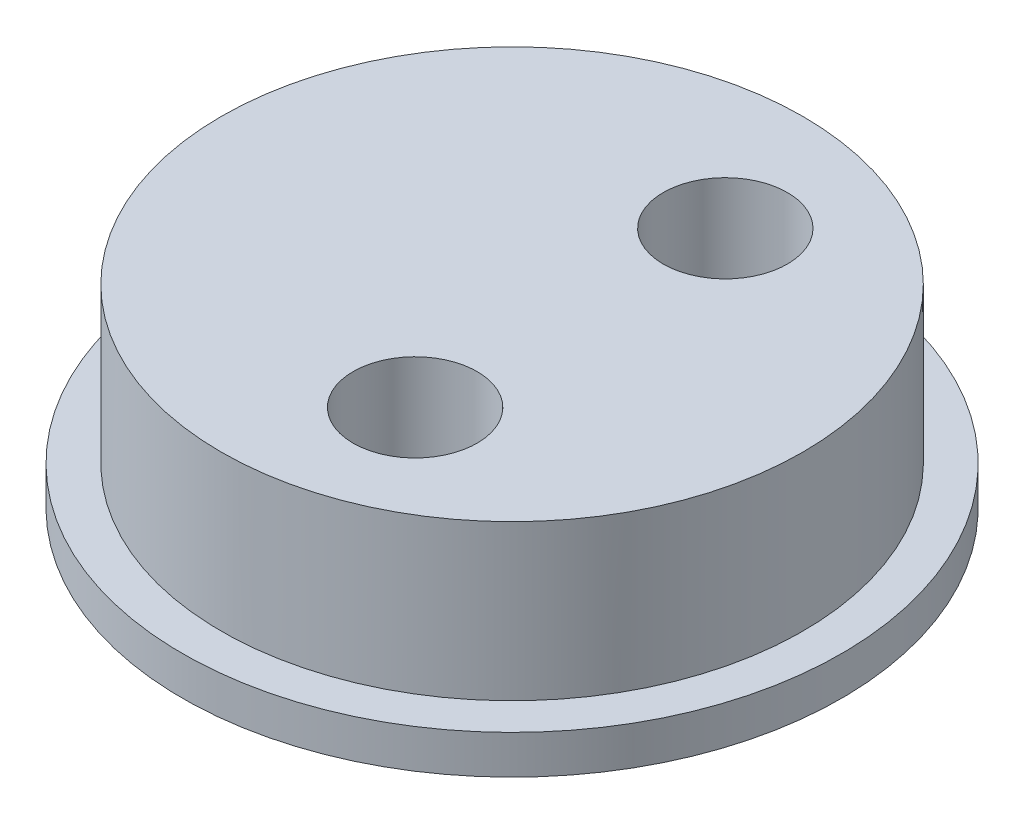
from build123d import *

# Parameters (mm, degrees)
SKETCH1_R           = 7.5
BOSS_EXTRUDE1_DEPTH = 5
SKETCH2_R           = 8.5
BOSS_EXTRUDE2_DEPTH = 1
SKETCH4_R           = 1.6
CUT_EXTRUDE1_DEPTH  = 15.044571905


with BuildPart() as part:
    # Sketch1 → Boss-Extrude1 (new body)
    with BuildSketch(Plane(origin=(0, 0, 0), x_dir=(1, 0, 0), z_dir=(0, 1, 0))):
        with Locations((-1.5, 0)):
            Circle(SKETCH1_R)
    extrude(amount=BOSS_EXTRUDE1_DEPTH)

    # Sketch2 → Boss-Extrude2 (add)
    with BuildSketch(Plane.XZ):
        with Locations((-1.5, 0)):
            Circle(SKETCH2_R)
    extrude(amount=-BOSS_EXTRUDE2_DEPTH)

    # Sketch4 → Cut-Extrude1 (cut, through all)
    with BuildSketch(Plane(origin=(0, 5, 0), x_dir=(1, 0, 0), z_dir=(0, 1, 0))):
        with Locations((0, 4)):
            Circle(SKETCH4_R)
        with Locations((0, -4)):
            Circle(SKETCH4_R)
    extrude(amount=-CUT_EXTRUDE1_DEPTH, mode=Mode.SUBTRACT)


solid = part.part
